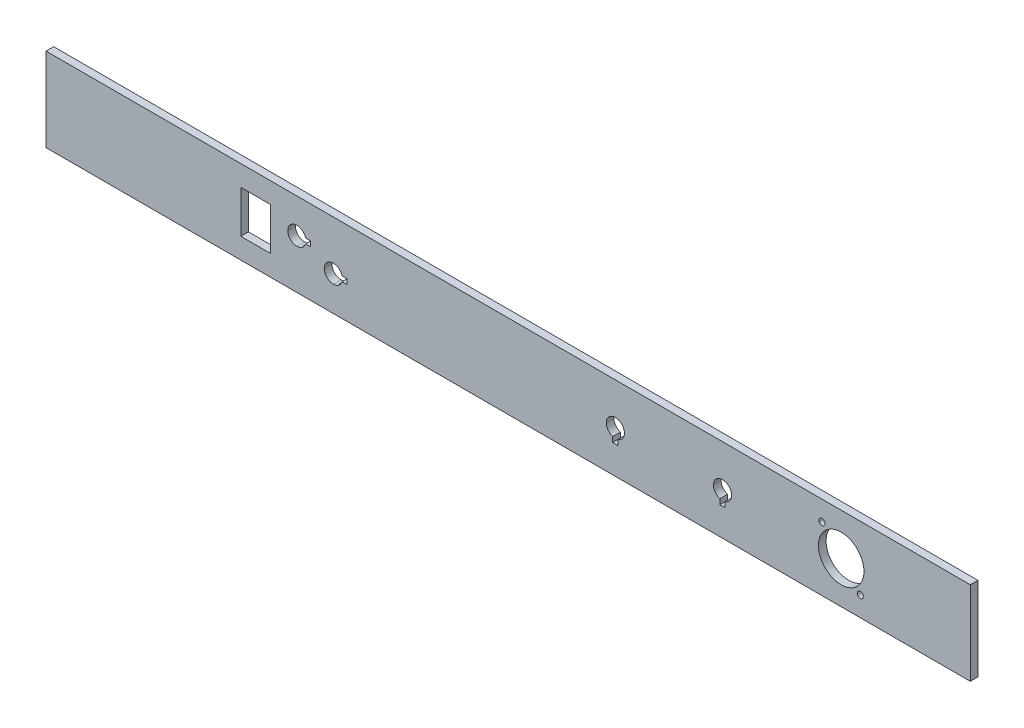
from build123d import *

# Parameters (mm, degrees)
SKETCH1_W           = 483
SKETCH1_H           = 43.7
BOSS_EXTRUDE1_DEPTH = 4
SKETCH2_R           = 11.9
SKETCH2_R_2         = 1.6
SKETCH2_W           = 15.419852382
SKETCH2_H           = 22.139786355
CUT_EXTRUDE1_DEPTH  = 4


with BuildPart() as part:
    # Sketch1 → Boss-Extrude1 (new body)
    with BuildSketch(Plane.XY):
        Rectangle(SKETCH1_W, SKETCH1_H)
    extrude(amount=BOSS_EXTRUDE1_DEPTH)

    # Sketch2 → Cut-Extrude1 (cut)
    with BuildSketch(Plane.XY.offset(4)):
        with Locations((173.993165462, 0)):
            Circle(SKETCH2_R)
        with Locations((183.993165462, -11.5)):
            Circle(SKETCH2_R_2)
        with Locations((163.993165462, 11.5)):
            Circle(SKETCH2_R_2)
        with Locations((-131.998126785, 0.004549598)):
            Rectangle(SKETCH2_W, SKETCH2_H)
        with BuildLine():
            Line((110.634956288, -7.311215886), (113.277465434, -7.311215886))
            Line((113.277465434, -7.311215886), (113.277465434, -4.659409192))
            add(Edge.make_bspline(
                [(113.277465434, -4.659409192), (115.28093114, -4.102835429), (116.757388152, -2.262363819), (116.757388152, -0.081560848)],
                knots=[0, 0, 0, 0, 1, 1, 1, 1], degree=3))
            add(Edge.make_bspline(
                [(116.757388152, -0.081560848), (116.757388152, 2.540418575), (114.634039351, 4.66376029), (112.012038669, 4.66376029)],
                knots=[0, 0, 0, 0, 1, 1, 1, 1], degree=3))
            add(Edge.make_bspline(
                [(112.012038669, 4.66376029), (109.390045073, 4.66376029), (107.25738455, 2.540418575), (107.25738455, -0.081560848)],
                knots=[0, 0, 0, 0, 1, 1, 1, 1], degree=3))
            add(Edge.make_bspline(
                [(107.25738455, -0.081560848), (107.25738455, -2.225336618), (108.683566063, -4.041873419), (110.634956288, -4.631495288)],
                knots=[0, 0, 0, 0, 1, 1, 1, 1], degree=3))
            Line((110.634956288, -4.631495288), (110.634956288, -7.311215886))
        make_face()
        with BuildLine():
            Line((54.634987856, -7.178454325), (57.277497002, -7.178454325))
            Line((57.277497002, -7.178454325), (57.277497002, -4.526647632))
            add(Edge.make_bspline(
                [(57.277497002, -4.526647632), (59.280962708, -3.970073868), (60.757419721, -2.129602259), (60.757419721, 0.051200713)],
                knots=[0, 0, 0, 0, 1, 1, 1, 1], degree=3))
            add(Edge.make_bspline(
                [(60.757419721, 0.051200713), (60.757419721, 2.673180136), (58.634070919, 4.79652185), (56.012070237, 4.79652185)],
                knots=[0, 0, 0, 0, 1, 1, 1, 1], degree=3))
            add(Edge.make_bspline(
                [(56.012070237, 4.79652185), (53.390076641, 4.79652185), (51.257416119, 2.673180136), (51.257416119, 0.051200713)],
                knots=[0, 0, 0, 0, 1, 1, 1, 1], degree=3))
            add(Edge.make_bspline(
                [(51.257416119, 0.051200713), (51.257416119, -2.092575057), (52.683597632, -3.909111858), (54.634987856, -4.498733728)],
                knots=[0, 0, 0, 0, 1, 1, 1, 1], degree=3))
            Line((54.634987856, -4.498733728), (54.634987856, -7.178454325))
        make_face()
        with BuildLine():
            Line((-105.863032724, 2.437431633), (-103.183312126, 2.437431633))
            Line((-103.183312126, 2.437431633), (-103.183312126, 5.079940778))
            Line((-103.183312126, 5.079940778), (-105.835122364, 5.079940778))
            add(Edge.make_bspline(
                [(-105.835122364, 5.079940778), (-106.391696127, 7.083406485), (-108.232164193, 8.559863497), (-110.412967165, 8.559863497)],
                knots=[0, 0, 0, 0, 1, 1, 1, 1], degree=3))
            add(Edge.make_bspline(
                [(-110.412967165, 8.559863497), (-113.034946587, 8.559863497), (-115.158291846, 6.436514696), (-115.158291846, 3.814514013)],
                knots=[0, 0, 0, 0, 1, 1, 1, 1], degree=3))
            add(Edge.make_bspline(
                [(-115.158291846, 3.814514013), (-115.158291846, 1.192520417), (-113.034946587, -0.940136562), (-110.412967165, -0.940136562)],
                knots=[0, 0, 0, 0, 1, 1, 1, 1], degree=3))
            add(Edge.make_bspline(
                [(-110.412967165, -0.940136562), (-108.269191395, -0.940136562), (-106.452654594, 0.486044951), (-105.863032724, 2.437431633)],
                knots=[0, 0, 0, 0, 1, 1, 1, 1], degree=3))
        make_face()
        with BuildLine():
            Line((-86.813217733, -5.182493655), (-84.133497135, -5.182493655))
            Line((-84.133497135, -5.182493655), (-84.133497135, -2.539984509))
            Line((-84.133497135, -2.539984509), (-86.785303829, -2.539984509))
            add(Edge.make_bspline(
                [(-86.785303829, -2.539984509), (-87.341877592, -0.536518803), (-89.182349202, 0.939938209), (-91.363152173, 0.939938209)],
                knots=[0, 0, 0, 0, 1, 1, 1, 1], degree=3))
            add(Edge.make_bspline(
                [(-91.363152173, 0.939938209), (-93.985131596, 0.939938209), (-96.108473311, -1.183410592), (-96.108473311, -3.805411275)],
                knots=[0, 0, 0, 0, 1, 1, 1, 1], degree=3))
            add(Edge.make_bspline(
                [(-96.108473311, -3.805411275), (-96.108473311, -6.427404871), (-93.985131596, -8.560065393), (-91.363152173, -8.560065393)],
                knots=[0, 0, 0, 0, 1, 1, 1, 1], degree=3))
            add(Edge.make_bspline(
                [(-91.363152173, -8.560065393), (-89.219376404, -8.560065393), (-87.402839602, -7.13388388), (-86.813217733, -5.182493655)],
                knots=[0, 0, 0, 0, 1, 1, 1, 1], degree=3))
        make_face()
    extrude(amount=-CUT_EXTRUDE1_DEPTH, mode=Mode.SUBTRACT)


solid = part.part
